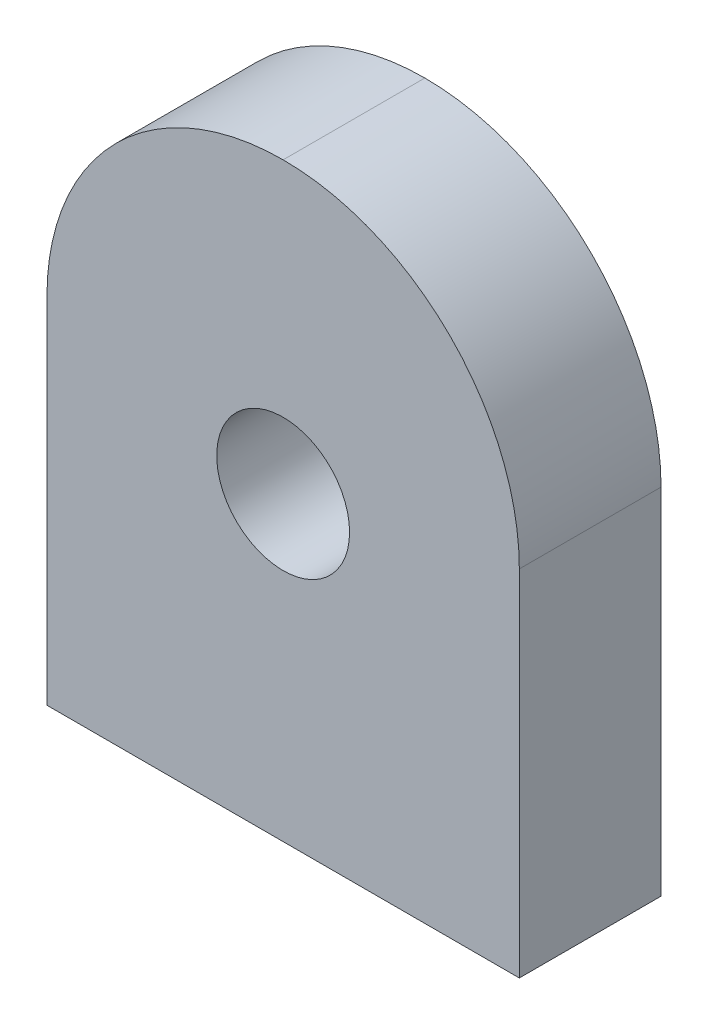
from build123d import *

# Parameters (mm, degrees)
SKETCH1_W           = 16
SKETCH1_H           = 20
BOSS_EXTRUDE1_DEPTH = 4.8
SKETCH2_R           = 2.25
CUT_EXTRUDE1_DEPTH  = 27.05839596
FILLET1_R           = 8


with BuildPart() as part:
    # Sketch1 → Boss-Extrude1 (new body)
    with BuildSketch(Plane.XY):
        with Locations((8, 10)):
            Rectangle(SKETCH1_W, SKETCH1_H)
    extrude(amount=BOSS_EXTRUDE1_DEPTH)

    # Sketch2 → Cut-Extrude1 (cut, through all)
    with BuildSketch(Plane.XY.offset(4.8)):
        with Locations((8, 10.2)):
            Circle(SKETCH2_R)
    extrude(amount=-CUT_EXTRUDE1_DEPTH, mode=Mode.SUBTRACT)

    # Fillet1
    fillet1_edges = [part.edges().sort_by_distance(p)[0] for p in [
        (16, 20, 2.4),
        (0, 20, 2.4),
    ]]
    fillet(fillet1_edges, radius=FILLET1_R - 0.0001)  # a hair under: the kernel refuses the full size


solid = part.part
